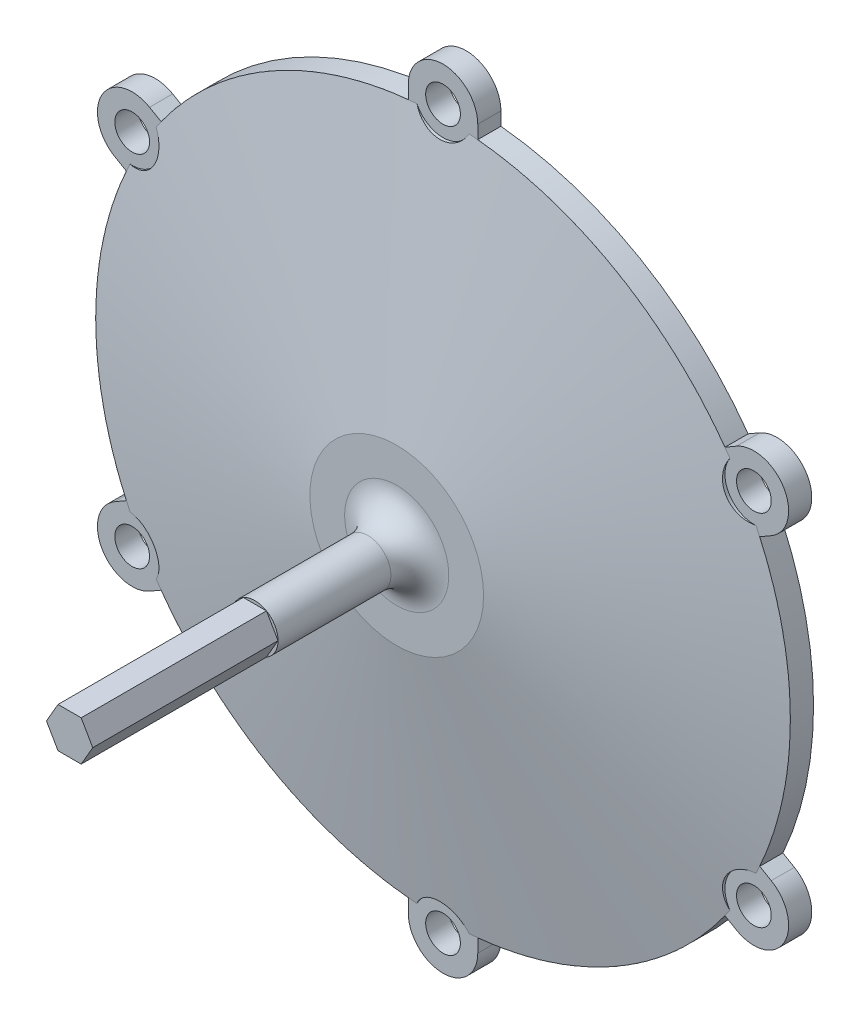
from build123d import *

# Parameters (mm, degrees)
SKETCH1_R           = 57
BOSS_EXTRUDE1_DEPTH = 4
SKETCH4_R           = 14
CUT_EXTRUDE1_DEPTH  = 7
SKETCH9_R           = 11.5
CUT_EXTRUDE4_DEPTH  = 0.5
SKETCH10_R          = 4
BOSS_EXTRUDE2_DEPTH = 56.5
FILLET1_R           = 5
SKETCH7_R           = 3
CUT_EXTRUDE2_DEPTH  = 112.284545198
SKETCH8_R           = 5
CUT_EXTRUDE3_DEPTH  = 112.284545198
CIRPATTERN6_COUNT   = 6
CUT_EXTRUDE5_DEPTH  = 32


with BuildPart() as part:
    # Sketch1 → Boss-Extrude1 (new body)
    with BuildSketch(Plane.XY):
        with BuildLine():
            ThreePointArc((6, 62), (0, 68), (-6, 62))
            Line((-6, 62), (-6, 59.699246226))
            ThreePointArc((-6, 59.699246226), (-30, 51.961524227), (-48.701063819, 35.045775536))
            Line((-48.701063819, 35.045775536), (-50.693575035, 36.196152423))
            ThreePointArc((-50.693575035, 36.196152423), (-58.889727457, 34), (-56.693575035, 25.803847577))
            Line((-56.693575035, 25.803847577), (-54.701063819, 24.65347069))
            ThreePointArc((-54.701063819, 24.65347069), (-60, 0), (-54.701063819, -24.65347069))
            Line((-54.701063819, -24.65347069), (-56.693575035, -25.803847577))
            ThreePointArc((-56.693575035, -25.803847577), (-58.889727457, -34), (-50.693575035, -36.196152423))
            Line((-50.693575035, -36.196152423), (-48.701063819, -35.045775536))
            ThreePointArc((-48.701063819, -35.045775536), (-30, -51.961524227), (-6, -59.699246226))
            Line((-6, -59.699246226), (-6, -62))
            ThreePointArc((-6, -62), (0, -68), (6, -62))
            Line((6, -62), (6, -59.699246226))
            ThreePointArc((6, -59.699246226), (30, -51.961524227), (48.701063819, -35.045775536))
            Line((48.701063819, -35.045775536), (50.693575035, -36.196152423))
            ThreePointArc((50.693575035, -36.196152423), (58.889727457, -34), (56.693575035, -25.803847577))
            Line((56.693575035, -25.803847577), (54.701063819, -24.65347069))
            ThreePointArc((54.701063819, -24.65347069), (60, 0), (54.701063819, 24.65347069))
            Line((54.701063819, 24.65347069), (56.693575035, 25.803847577))
            ThreePointArc((56.693575035, 25.803847577), (58.889727457, 34), (50.693575035, 36.196152423))
            Line((50.693575035, 36.196152423), (48.701063819, 35.045775536))
            ThreePointArc((48.701063819, 35.045775536), (30, 51.961524227), (6, 59.699246226))
            Line((6, 59.699246226), (6, 62))
        make_face()
        Circle(SKETCH1_R, mode=Mode.SUBTRACT)
    extrude(amount=BOSS_EXTRUDE1_DEPTH)

    # Sketch7 → Cut-Extrude2 (cut, through all)
    with BuildSketch(Plane.XY.offset(4)):
        with Locations((0, 62)):
            Circle(SKETCH7_R)
    cut_extrude2 = extrude(amount=-CUT_EXTRUDE2_DEPTH, mode=Mode.SUBTRACT)


with BuildPart() as body_2:
    # Sketch3 → Revolve1 (revolve)
    with BuildSketch(Plane(origin=(0, 0, 0), x_dir=(1, 0, 0), z_dir=(0, 1, 0))):
        Polygon((0, -0.5), (0, -12), (15, -12), (60, -4), (57, -4), (57, -0.5), align=None)
    revolve(axis=Axis((0, 0, 12), (0, 0, -1)))

    # Sketch4 → Cut-Extrude1 (cut)
    with BuildSketch(Plane.XY.offset(0.5)):
        Circle(SKETCH4_R)
    extrude(amount=CUT_EXTRUDE1_DEPTH, mode=Mode.SUBTRACT)

    # Sketch9 → Cut-Extrude4 (cut)
    with BuildSketch(Plane(origin=(0, 0, 7.5), x_dir=(-1, 0, 0), z_dir=(0, 0, -1))):
        Circle(SKETCH9_R)
    extrude(amount=-CUT_EXTRUDE4_DEPTH, mode=Mode.SUBTRACT)

    # Sketch10 → Boss-Extrude2 (add)
    with BuildSketch(Plane.XY.offset(12)):
        Circle(SKETCH10_R)
    extrude(amount=BOSS_EXTRUDE2_DEPTH)

    # Fillet1
    fillet1_edges = [body_2.edges().sort_by_distance(p)[0] for p in [
        (-4, 0, 12),
    ]]
    fillet(fillet1_edges, radius=FILLET1_R)

    # Sketch8 → Cut-Extrude3 (cut, through all)
    with BuildSketch(Plane.XY.offset(4)):
        with Locations((0, 62)):
            Circle(SKETCH8_R)
    cut_extrude3 = extrude(amount=CUT_EXTRUDE3_DEPTH, mode=Mode.SUBTRACT)


with BuildPart() as cirpattern6_tool:
    # CirPattern6: Cut-Extrude2, Cut-Extrude3 ×6 about axis
    cirpattern6_axis = Axis((0, 0, 4), (0, 0, 1))
    add([cut_extrude2.rotate(cirpattern6_axis, i * 360 / CIRPATTERN6_COUNT) for i in range(1, CIRPATTERN6_COUNT)])
    add([cut_extrude3.rotate(cirpattern6_axis, i * 360 / CIRPATTERN6_COUNT) for i in range(1, CIRPATTERN6_COUNT)])


with BuildPart() as part_1:
    add(part.part)

    # CirPattern6: cut by cirpattern6_tool
    add(cirpattern6_tool.part, mode=Mode.SUBTRACT)


with BuildPart() as body_2_1:
    add(body_2.part)

    # CirPattern6: cut by cirpattern6_tool
    add(cirpattern6_tool.part, mode=Mode.SUBTRACT)

    # Sketch11 → Cut-Extrude5 (cut)
    with BuildSketch(Plane.XY.offset(68.5)):
        with BuildLine():
            ThreePointArc((4, 0), (3.464101615, 2), (2, 3.464101615))
            Line((2, 3.464101615), (4, 0))
        make_face()
        with BuildLine():
            Line((-2, 3.464101615), (2, 3.464101615))
            ThreePointArc((2, 3.464101615), (0, 4), (-2, 3.464101615))
        make_face()
        with BuildLine():
            Line((-4, 0), (-2, 3.464101615))
            ThreePointArc((-2, 3.464101615), (-3.464101615, 2), (-4, 0))
        make_face()
        with BuildLine():
            ThreePointArc((2, -3.464101615), (3.464101615, -2), (4, 0))
            Line((4, 0), (2, -3.464101615))
        make_face()
        with BuildLine():
            Line((-2, -3.464101615), (-4, 0))
            ThreePointArc((-4, 0), (-3.464101615, -2), (-2, -3.464101615))
        make_face()
        with BuildLine():
            ThreePointArc((-2, -3.464101615), (0, -4), (2, -3.464101615))
            Line((2, -3.464101615), (-2, -3.464101615))
        make_face()
    extrude(amount=-CUT_EXTRUDE5_DEPTH, mode=Mode.SUBTRACT)


solid = Compound([part_1.part, body_2_1.part])
